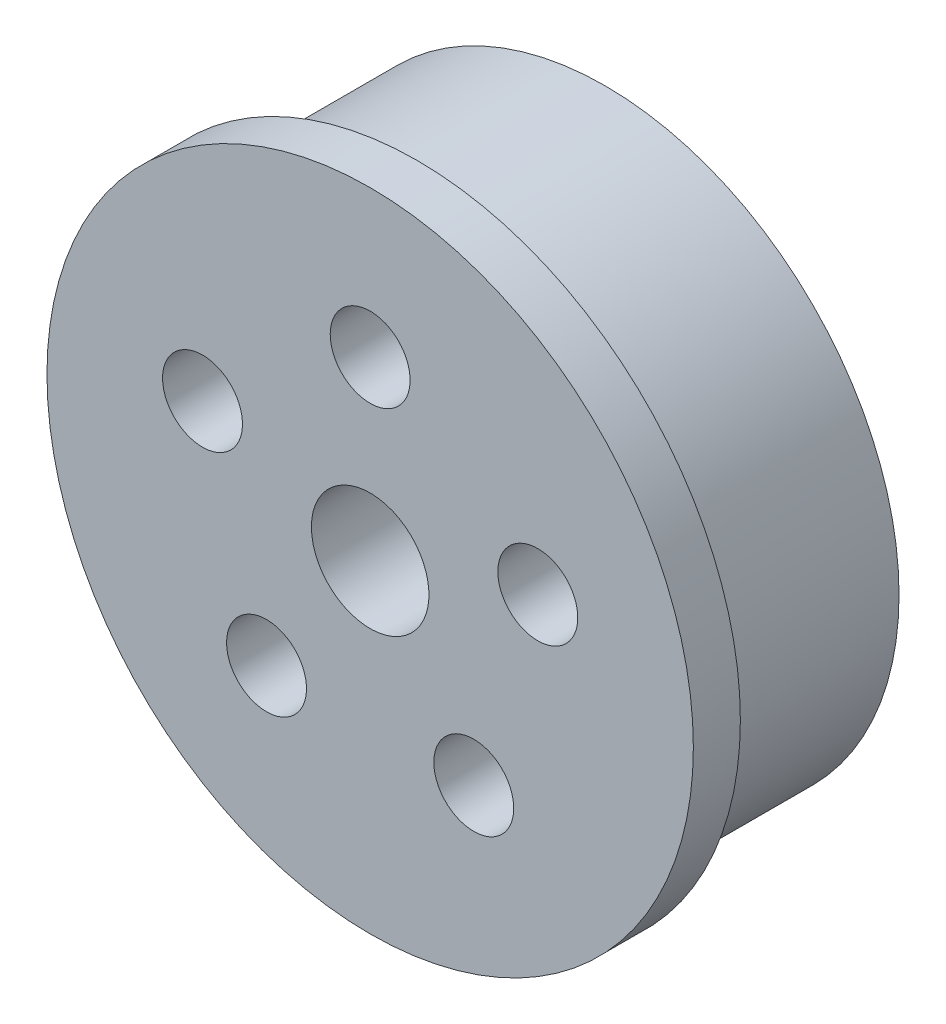
from build123d import *

# Parameters (mm, degrees)
SKETCH_1_R                   = 12.5
SKETCH_1_R_2                 = 1.5
EXTRUDE_1_DEPTH              = 10
EXTRUDE_START                = -2
SKETCH_3_R                   = 13.75
SKETCH_3_R_2                 = 12.5
EXTRUDE_3_DEPTH              = 2
SKETCH_4_R                   = 2.5
CUT_EXTRUDE_1_DEPTH          = 22.866069606
HOLE_WIZARD_M3_1_D           = 3.4
HOLE_WIZARD_M3_1_CBORE_D     = 7
HOLE_WIZARD_M3_1_CBORE_DEPTH = 4


with BuildPart() as part:
    # ｽｹｯﾁ1 → ﾎﾞｽ - 押し出し1 (new body)
    with BuildSketch(Plane.XY):
        Circle(SKETCH_1_R)
        with Locations((0, 7.5)):
            Circle(SKETCH_1_R_2, mode=Mode.SUBTRACT)
        with Locations((7.132923872, 2.317627458)):
            Circle(SKETCH_1_R_2, mode=Mode.SUBTRACT)
        with Locations((4.408389392, -6.067627458)):
            Circle(SKETCH_1_R_2, mode=Mode.SUBTRACT)
        with Locations((-4.408389392, -6.067627458)):
            Circle(SKETCH_1_R_2, mode=Mode.SUBTRACT)
        with Locations((-7.132923872, 2.317627458)):
            Circle(SKETCH_1_R_2, mode=Mode.SUBTRACT)
    extrude(amount=EXTRUDE_1_DEPTH)

    # ｽｹｯﾁ3 → ﾎﾞｽ - 押し出し3 (add)
    with BuildSketch(Plane.XY.offset(10).offset(EXTRUDE_START)):
        Circle(SKETCH_3_R)
        Circle(SKETCH_3_R_2, mode=Mode.SUBTRACT)
    extrude(amount=EXTRUDE_3_DEPTH)

    # ｽｹｯﾁ4 → ｶｯﾄ - 押し出し1 (cut, through all)
    with BuildSketch(Plane(origin=(0, 0, 0), x_dir=(-1, 0, 0), z_dir=(0, 0, -1))):
        Circle(SKETCH_4_R)
    extrude(amount=-CUT_EXTRUDE_1_DEPTH, mode=Mode.SUBTRACT)

    # M3 穴付きねじ用座ぐり穴1 (through all)
    with Locations(Plane(origin=(0, 0, 0), x_dir=(-1, 0, 0), z_dir=(0, 0, -1))):
        with Locations((0, 7.5), (7.132923872, 2.317627458), (4.408389392, -6.067627458), (-4.408389392, -6.067627458), (-7.132923872, 2.317627458)):
            CounterBoreHole(HOLE_WIZARD_M3_1_D / 2, HOLE_WIZARD_M3_1_CBORE_D / 2, HOLE_WIZARD_M3_1_CBORE_DEPTH)


solid = part.part
